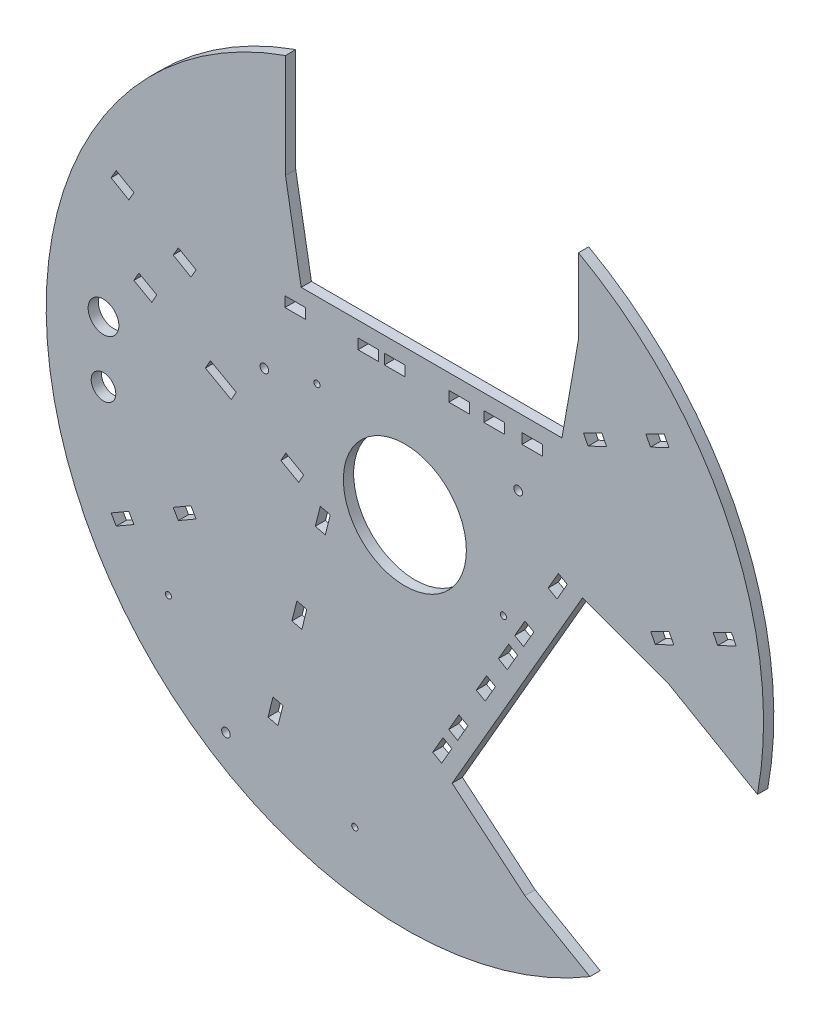
from build123d import *

# Parameters (mm, degrees)
ESQUISSE1_R             = 175
BOSS_EXTRU_1_DEPTH      = 5
ENL_V_MAT_EXTRU_1_DEPTH = 5
ESQUISSE3_W             = 10
ESQUISSE3_H             = 5
ENL_V_MAT_EXTRU_2_DEPTH = 10
ESQUISSE4_R             = 1.5
ENL_V_MAT_EXTRU_3_DEPTH = 10
ENL_V_MAT_EXTRU_4_DEPTH = 10
ESQUISSE6_W             = 10
ESQUISSE6_H             = 5
ENL_V_MAT_EXTRU_5_DEPTH = 5
TROU_TARAUD_M51_D       = 4.2
ESQUISSE10_R            = 30
ESQUISSE10_R_2          = 6
ESQUISSE10_R_3          = 7.5
ENL_V_MAT_EXTRU_6_DEPTH = 5


with BuildPart() as part:
    # Esquisse1 → Boss.-Extru.1 (new body)
    with BuildSketch(Plane.XY):
        Circle(ESQUISSE1_R)
    extrude(amount=BOSS_EXTRU_1_DEPTH)

    # Esquisse2 → Enlèv. mat.-Extru.1 (cut)
    with BuildSketch(Plane(origin=(0, 0, 0), x_dir=(-1, 0, 0), z_dir=(0, 0, -1))):
        Polygon((58.240826849, 114.332025077), (58.240826849, 213.87663255), (-84.681680643, 213.87663255), (-84.681680643, 116.513512453), (-76.636603499, 70.887612711), (50.580404788, 70.887612711), align=None)
        Polygon((-128.134851608, -6.727976949), (-214.343010489, -56.500280686), (-142.881756743, -180.274802947), (-58.562821347, -131.593242898), (-23.072171671, -101.813051845), (-86.680675815, 8.360109125), align=None)
    extrude(amount=-ENL_V_MAT_EXTRU_1_DEPTH, mode=Mode.SUBTRACT)

    # Esquisse3 → Enlèv. mat.-Extru.2 (cut)
    with BuildSketch(Plane.XY.offset(5)):
        Polygon((-49.356660547, -7.757843325), (-58.077491782, -2.864265639), (-60.524280625, -7.224681256), (-51.803449391, -12.118258943), align=None)
        Polygon((-82.29909118, 10.727360567), (-94.870678761, 17.781738621), (-97.317467605, 13.421323004), (-84.745880023, 6.36694495), align=None)
        Polygon((-121.033172465, 32.462471681), (-129.7540037, 37.356049368), (-132.200792544, 32.995633751), (-123.479961309, 28.102056064), align=None)
        Polygon((-36.411918308, -18.139201989), (-38.839769225, -27.840002983), (-43.690169722, -26.626077525), (-41.262318805, -16.925276531), align=None)
        Polygon((-47.8486979, -63.836374764), (-50.276548817, -73.537175758), (-55.126949314, -72.323250299), (-52.699098397, -62.622449305), align=None)
        Polygon((-59.476502021, -110.296811432), (-61.904352938, -119.997612426), (-66.754753435, -118.783686967), (-64.326902518, -109.082885973), align=None)
        Polygon((62.914433511, -18.00423005), (58.584306492, -15.50423005), (53.584306492, -24.164484088), (57.914433511, -26.664484088), align=None)
        Polygon((39.851125271, -47.951051713), (44.18125229, -50.451051713), (39.18125229, -59.11130575), (34.851125271, -56.61130575), align=None)
        Polygon((18.584306492, -84.786262353), (22.914433511, -87.286262353), (17.914433511, -95.946516391), (13.584306492, -93.446516391), align=None)
        with Locations((62.155135581, 60.887612711)):
            Rectangle(ESQUISSE3_W, ESQUISSE3_H)
        with Locations((-17.844864419, 60.887612711)):
            Rectangle(ESQUISSE3_W, ESQUISSE3_H)
        with Locations((26.44406925, 60.887612711)):
            Rectangle(ESQUISSE3_W, ESQUISSE3_H)
        Polygon((122.148385312, 6.310171572), (119.963600629, 10.807583704), (128.958424895, 15.177153069), (131.143209577, 10.679740937), align=None)
        Polygon((159.379066535, 29.955107573), (150.38424227, 25.585538209), (152.569026952, 21.088126076), (161.563851217, 25.457695441), align=None)
        Polygon((126.607296299, 97.416289564), (117.612472034, 93.046720199), (119.797256716, 88.549308067), (128.792080981, 92.918877432), align=None)
        Polygon((96.186654659, 82.63833506), (98.371439341, 78.140922927), (89.376615076, 73.771353563), (87.191830393, 78.268765695), align=None)
    extrude(amount=-ENL_V_MAT_EXTRU_2_DEPTH, mode=Mode.SUBTRACT)

    # Esquisse4 → Enlèv. mat.-Extru.3 (cut)
    with BuildSketch(Plane(origin=(0, 0, 0), x_dir=(-1, 0, 0), z_dir=(0, 0, -1))):
        with Locations((115.362702052, -91.589286674)):
            Circle(ESQUISSE4_R)
        with Locations((24.430034655, -144.089286674)):
            Circle(ESQUISSE4_R)
        with Locations((-48.069965345, -18.515603125)):
            Circle(ESQUISSE4_R)
        with Locations((42.862702052, 33.984396875)):
            Circle(ESQUISSE4_R)
    extrude(amount=-ENL_V_MAT_EXTRU_3_DEPTH, mode=Mode.SUBTRACT)

    # Esquisse5 → Enlèv. mat.-Extru.4 (cut)
    with BuildSketch(Plane(origin=(0, 0, 0), x_dir=(-1, 0, 0), z_dir=(0, 0, -1))):
        Polygon((132.178427666, -70.125229259), (134.678427666, -65.79510224), (143.338681704, -70.79510224), (140.838681704, -75.125229259), align=None)
        Polygon((110.527792572, -57.625229259), (113.027792572, -53.29510224), (104.367538534, -48.29510224), (101.867538534, -52.625229259), align=None)
        Polygon((134.678427666, 65.79510224), (132.178427666, 70.125229259), (140.838681704, 75.125229259), (143.338681704, 70.79510224), align=None)
        Polygon((110.527792572, 57.625229259), (113.027792572, 53.29510224), (104.367538534, 48.29510224), (101.867538534, 52.625229259), align=None)
    extrude(amount=-ENL_V_MAT_EXTRU_4_DEPTH, mode=Mode.SUBTRACT)

    # Esquisse6 → Enlèv. mat.-Extru.5 (cut)
    with BuildSketch(Plane.XY.offset(5)):
        Polygon((25.731885433, -82.406292477), (30.731885433, -73.746038439), (26.401758414, -71.246038439), (21.401758414, -79.906292477), align=None)
        Polygon((49.981885433, -40.404060393), (54.981885433, -31.743806355), (50.651758414, -29.243806355), (45.651758414, -37.904060393), align=None)
        with Locations((43.5, 60.887612711)):
            Rectangle(ESQUISSE6_W, ESQUISSE6_H)
        Polygon((74.901758414, 12.758425728), (69.901758414, 4.09817169), (74.231885433, 1.59817169), (79.231885433, 10.258425728), align=None)
        with Locations((-5, 60.887612711)):
            Rectangle(ESQUISSE6_W, ESQUISSE6_H)
        with Locations((-53.5, 60.887612711)):
            Rectangle(ESQUISSE6_W, ESQUISSE6_H)
    extrude(amount=-ENL_V_MAT_EXTRU_5_DEPTH, mode=Mode.SUBTRACT)

    # Trou taraudé M51 (through all)
    with Locations(Plane(origin=(0, 0, -85), x_dir=(1, 0, 0), z_dir=(0, 0, -1))):
        with Locations((-68.568956805, -27.662548456), (55.280905682, -37.98337033), (-87.299337242, 135.559338217)):
            Hole(TROU_TARAUD_M51_D / 2)

    # Esquisse10 → Enlèv. mat.-Extru.6 (cut)
    with BuildSketch(Plane.XY.offset(5)):
        Circle(ESQUISSE10_R)
        with Locations((-147.042149298, -19.335087814)):
            Circle(ESQUISSE10_R_2)
        with Locations((-147.042149298, 10.187091802)):
            Circle(ESQUISSE10_R_3)
    extrude(amount=-ENL_V_MAT_EXTRU_6_DEPTH, mode=Mode.SUBTRACT)


solid = part.part
